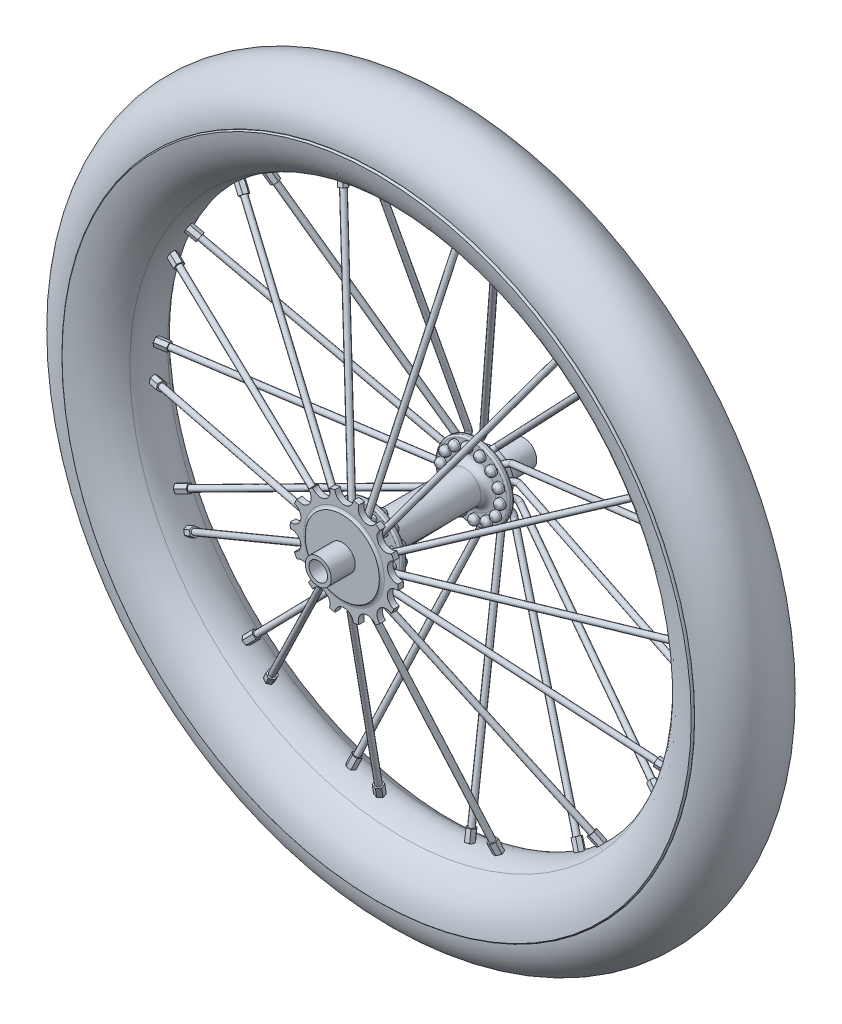
from build123d import *
from build123d.topology import SkipClean

# Parameters (mm, degrees)
BOSS_EXTRUDE1_DEPTH       = 38.5
BOSS_EXTRUDE1_DEPTH_BACK  = 38.5
SKETCH3_R                 = 8.8
SKETCH3_R_2               = 5
SKETCH4_R                 = 4.981501492
BOSS_EXTRUDE2_DEPTH       = 4
SKETCH5_R                 = 11.5
SKETCH5_R_2               = 5
BOSS_EXTRUDE3_DEPTH       = 4
SKETCH6_R                 = 10
SKETCH6_R_2               = 5
BOSS_EXTRUDE4_DEPTH       = 4
FILLET4_R                 = 2
FILLET5_R                 = 2
SKETCH7_W                 = 15
SKETCH7_H                 = 3
FILLET6_R                 = 4
FILLET7_R                 = 1
SKETCH8_R                 = 7
SKETCH8_R_2               = 5
BOSS_EXTRUDE5_DEPTH       = 2
SKETCH9_R                 = 7
SKETCH9_R_2               = 5
BOSS_EXTRUDE8_DEPTH       = 4
SKETCH18_R                = 1.5
BOSS_EXTRUDE14_DEPTH      = 6
BOSS_EXTRUDE15_REACH      = 283.201
SKETCH21_R                = 2.5
FILLET12_R                = 2
CIRPATTERN3_COUNT         = 14
FILLET12_OF_CIRPATTERN3_R = 2
SKETCH22_R                = 1.5
BOSS_EXTRUDE16_REACH      = 282.717
SKETCH23_R                = 2.5
FILLET13_R                = 2
BOSS_EXTRUDE17_DEPTH      = 6
CIRPATTERN9_COUNT         = 14
FILLET13_OF_CIRPATTERN9_R = 2
SKETCH25_R                = 32.935740121
SKETCH25_R_2              = 20
CUT_EXTRUDE1_DEPTH        = 1
FILLET15_R                = 2
BOSS_EXTRUDE18_START      = 13
SKETCH26_R                = 7
SKETCH26_R_2              = 5
BOSS_EXTRUDE18_DEPTH      = 13
SKETCH27_R                = 7
SKETCH27_R_2              = 5
BOSS_EXTRUDE19_DEPTH      = 10.98


with BuildPart() as part:
    # Sketch1 → Revolve2 (revolve)
    with BuildSketch(Plane(origin=(0, 0, 0), x_dir=(0, 0, -1), z_dir=(1, 0, 0))):
        with BuildLine():
            ThreePointArc((-22.5, 170.26), (0, 192.76), (22.5, 170.26))
            ThreePointArc((22.5, 170.26), (23.315391381, 170.379013753), (23.943306285, 169.845393804))
            add(Edge.make_bspline(
                [(23.943306285, 169.845393804), (22.620135463, 160.054080941), (18.884769085, 152.565473915), (10.191867865, 146.984496369)],
                knots=[0, 0, 0, 0, 1, 1, 1, 1], degree=3))
            add(Edge.make_bspline(
                [(-10.191867865, 146.984496369), (-7.742835299, 145.412179439), (0.19376169, 143.732218575), (7.355311919, 145.163383412), (10.191867865, 146.984496369)],
                knots=[0, 0, 0, 0, 0.5, 1, 1, 1, 1], degree=3))
            add(Edge.make_bspline(
                [(-23.943306285, 169.845393804), (-22.620135463, 160.054080941), (-18.884769085, 152.565473915), (-10.191867865, 146.984496369)],
                knots=[0, 0, 0, 0, 1, 1, 1, 1], degree=3))
            ThreePointArc((-23.943306285, 169.845393804), (-23.315391381, 170.379013753), (-22.5, 170.26))
        make_face()
    revolve(axis=Axis((0, 0, 0), (0, 0, 1)))



with BuildPart() as body_2:
    # Sketch3 → Boss-Extrude1 (new, two sides: drawn at the far end of the back side and taken through both)
    with BuildSketch(Plane.XY.offset(-BOSS_EXTRUDE1_DEPTH_BACK)):
        Circle(SKETCH3_R)
        Circle(SKETCH3_R_2, mode=Mode.SUBTRACT)
    extrude(amount=BOSS_EXTRUDE1_DEPTH + BOSS_EXTRUDE1_DEPTH_BACK)

    # Sketch4 → Boss-Extrude2 (add)
    with BuildSketch(Plane.XY.offset(38.5)):
        with BuildLine():
            ThreePointArc((-4.981501492, 28.660299072), (-6.473133969, 28.360652965), (-7.947059966, 27.983429702))
            ThreePointArc((-7.947059966, 27.983429702), (-10.452259275, 21.704340028), (-16.923415485, 23.660644715))
            ThreePointArc((-16.923415485, 23.660644715), (-18.137318336, 22.743477825), (-19.301608733, 21.764098886))
            ThreePointArc((-19.301608733, 21.764098886), (-18.834320413, 15.019869327), (-25.513439489, 13.974709493))
            ThreePointArc((-25.513439489, 13.974709493), (-26.209184367, 12.621677971), (-26.833237172, 11.234121366))
            ThreePointArc((-26.833237172, 11.234121366), (-23.486013404, 5.360529299), (-29.050213901, 1.520911668))
            ThreePointArc((-29.050213901, 1.520911668), (-29.09, 0), (-29.050213901, -1.520911668))
            ThreePointArc((-29.050213901, -1.520911668), (-23.486013404, -5.360529299), (-26.833237172, -11.234121366))
            ThreePointArc((-26.833237172, -11.234121366), (-26.209184367, -12.621677971), (-25.513439489, -13.974709493))
            ThreePointArc((-25.513439489, -13.974709493), (-18.834320413, -15.019869327), (-19.301608733, -21.764098886))
            ThreePointArc((-19.301608733, -21.764098886), (-18.137318336, -22.743477825), (-16.923415485, -23.660644715))
            ThreePointArc((-16.923415485, -23.660644715), (-10.452259275, -21.704340028), (-7.947059966, -27.983429702))
            ThreePointArc((-7.947059966, -27.983429702), (-6.473133969, -28.360652965), (-4.981501492, -28.660299072))
            ThreePointArc((-4.981501492, -28.660299072), (0, -24.09), (4.981501492, -28.660299072))
            ThreePointArc((4.981501492, -28.660299072), (6.473133969, -28.360652965), (7.947059966, -27.983429702))
            ThreePointArc((7.947059966, -27.983429702), (10.452259275, -21.704340028), (16.923415485, -23.660644715))
            ThreePointArc((16.923415485, -23.660644715), (18.137318336, -22.743477825), (19.301608733, -21.764098886))
            ThreePointArc((19.301608733, -21.764098886), (18.834320413, -15.019869327), (25.513439489, -13.974709493))
            ThreePointArc((25.513439489, -13.974709493), (26.209184367, -12.621677971), (26.833237172, -11.234121366))
            ThreePointArc((26.833237172, -11.234121366), (23.486013404, -5.360529299), (29.050213901, -1.520911668))
            ThreePointArc((29.050213901, -1.520911668), (29.09, 0), (29.050213901, 1.520911668))
            ThreePointArc((29.050213901, 1.520911668), (23.486013404, 5.360529299), (26.833237172, 11.234121366))
            ThreePointArc((26.833237172, 11.234121366), (26.209184367, 12.621677971), (25.513439489, 13.974709493))
            ThreePointArc((25.513439489, 13.974709493), (18.834320413, 15.019869327), (19.301608733, 21.764098886))
            ThreePointArc((19.301608733, 21.764098886), (18.137318336, 22.743477825), (16.923415485, 23.660644715))
            ThreePointArc((16.923415485, 23.660644715), (10.452259275, 21.704340028), (7.947059966, 27.983429702))
            ThreePointArc((7.947059966, 27.983429702), (6.473133969, 28.360652965), (4.981501492, 28.660299072))
            ThreePointArc((4.981501492, 28.660299072), (0, 24.09), (-4.981501492, 28.660299072))
        make_face()
        Circle(SKETCH4_R, mode=Mode.SUBTRACT)
    extrude(amount=BOSS_EXTRUDE2_DEPTH)



with BuildPart() as body_3:
    # Sketch5 → Boss-Extrude3 (new body)
    with BuildSketch(Plane(origin=(0, 0, 38.5), x_dir=(-1, 0, 0), z_dir=(0, 0, -1))):
        Circle(SKETCH5_R)
        Circle(SKETCH5_R_2, mode=Mode.SUBTRACT)
    extrude(amount=BOSS_EXTRUDE3_DEPTH)


with BuildPart() as body_4:
    # Sketch6 → Boss-Extrude4 (new body)
    with BuildSketch(Plane(origin=(0, 0, 34.5), x_dir=(-1, 0, 0), z_dir=(0, 0, -1))):
        Circle(SKETCH6_R)
        Circle(SKETCH6_R_2, mode=Mode.SUBTRACT)
    extrude(amount=BOSS_EXTRUDE4_DEPTH)


with BuildPart() as body_5:
    # Mirror2: mirrored copy
    add(body_4.part.mirror(Plane.XY))


with BuildPart() as body_6:
    # Mirror2 2: mirrored copy
    add(body_3.part.mirror(Plane.XY))

    # Fillet5
    fillet5_edges = [body_6.edges().sort_by_distance(p)[0] for p in [
        (11.5, 0, -34.5),
    ]]
    fillet(fillet5_edges, radius=FILLET5_R)


with BuildPart() as body_3_1:
    add(body_3.part)

    # Fillet4
    fillet4_edges = [body_3_1.edges().sort_by_distance(p)[0] for p in [
        (11.5, 0, 34.5),
    ]]
    fillet(fillet4_edges, radius=FILLET4_R)


with BuildPart() as body_2_1:
    add(body_2.part)

    add(body_4.part)  # Revolve3 merges body 4

    add(body_5.part)  # Revolve3 merges body 5
    # Sketch7 → Revolve3 (revolve)
    with BuildSketch(Plane(origin=(0, 0, 0), x_dir=(1, 0, 0), z_dir=(0, 1, 0)), mode=Mode.PRIVATE) as revolve3_sk:
        with Locations((-12.5, 29)):
            Rectangle(SKETCH7_W, SKETCH7_H)
        with Locations((-12.5, -29)):
            Rectangle(SKETCH7_W, SKETCH7_H)
    revolve(revolve3_sk.sketch.rotate(Axis((0, 0, -65.139844077), (0, 0, 1)), 180), axis=Axis((0, 0, -65.139844077), (0, 0, 1)))

    # Fillet6
    fillet6_edges = [body_2_1.edges().sort_by_distance(p)[0] for p in [
        (-8.8, 0, 27.5),
        (-8.8, 0, -27.5),
    ]]
    fillet(fillet6_edges, radius=FILLET6_R)

    # Fillet7
    fillet7_edges = [body_2_1.edges().sort_by_distance(p)[0] for p in [
        (-20, 0, 27.5),
        (-20, 0, 30.5),
        (-20, 0, -27.5),
        (-20, 0, -30.5),
    ]]
    fillet(fillet7_edges, radius=FILLET7_R)

    # Sketch8 → Boss-Extrude5 (add)
    with BuildSketch(Plane.XY.offset(42.5)):
        Circle(SKETCH8_R)
        with Locations(Location((0, 0, 0), (0, 0, 180))):
            Circle(SKETCH8_R_2, mode=Mode.SUBTRACT)
    extrude(amount=BOSS_EXTRUDE5_DEPTH)


    with SkipClean():  # the faces are left unmerged after this step: merging them gives an invalid solid
        add(body_6.part)  # Boss-Extrude8 merges body 6
        # Sketch9 → Boss-Extrude8 (add)
        with BuildSketch(Plane(origin=(0, 0, -38.5), x_dir=(-1, 0, 0), z_dir=(0, 0, -1))):
            with Locations(Location((0, 0, 0), (0, 0, 180))):
                Circle(SKETCH9_R)
            Circle(SKETCH9_R_2, mode=Mode.SUBTRACT)
        extrude(amount=BOSS_EXTRUDE8_DEPTH)


with BuildPart() as part_1:
    add(part.part)

    add(body_2_1.part)  # Sweep3 merges body 2
    # Sweep3: sweep along a curve in space
    with BuildLine() as sweep3_path:
        Line((-19.163004198, 3.603154675, -34.508286843), (-126.966537307, 69.032036164, -1.285413134))
        ThreePointArc((-15.945035065, 1.650082127, -31.607274386), (-16.944140106, 2.256466014, -33.983494651), (-19.163004198, 3.603154675, -34.508286843))
        Line((-15.945035065, 1.650082127, -27.5), (-15.945035065, 1.650082127, -31.607274386))
        Line((-15.945035065, 1.650082127, -27.5), (-15.945035065, 1.650082127, -24.5))
    # Sketch18 → Sweep3 (sweep)
    with BuildSketch(Plane(origin=(-126.966537307, 69.032036164, -1.285413134), x_dir=(0.21778703603627805, -0.1321808456530245, 0.9670041525127926), z_dir=(-0.826662203438829, 0.5017236613741118, 0.25476061120788623))):
        Circle(SKETCH18_R)
    sweep3 = sweep(path=sweep3_path.line)

    # Sketch20 → Boss-Extrude14 (add)
    with BuildSketch(Plane(origin=(-126.966537307, 69.032036164, -1.285413134), x_dir=(0.21778703603627805, -0.1321808456530245, 0.9670041525127926), z_dir=(-0.826662203438829, 0.5017236613741118, 0.25476061120788623))):
        Polygon((-2.229914802, -0.775034798), (-0.443757577, -2.318680265), (1.786157225, -1.543645468), (2.229914802, 0.775034798), (0.443757577, 2.318680265), (-1.786157225, 1.543645468), align=None)
    boss_extrude14 = extrude(amount=-BOSS_EXTRUDE14_DEPTH)

    # Sketch21 → Boss-Extrude15 (add, up to next)
    with BuildSketch(Plane.XY.offset(-24.5), mode=Mode.PRIVATE) as boss_extrude15_sk1:
        with Locations((-15.945035065, 1.650082127)):
            Circle(SKETCH21_R)
    boss_extrude15_tool1 = extrude(boss_extrude15_sk1.sketch, amount=-BOSS_EXTRUDE15_REACH, mode=Mode.PRIVATE) - part_1.part
    boss_extrude15 = boss_extrude15_tool1.solids().sort_by_distance((-15.945035, 1.650082, -24.5))[0]
    add(boss_extrude15)

    # Fillet12
    fillet12_edges = [part_1.edges().sort_by_distance(p)[0] for p in [
        (-18.445035065, 1.650082127, -24.5),
    ]]
    fillet(fillet12_edges, radius=FILLET12_R)

    # CirPattern3: Sweep3, Boss-Extrude14, Boss-Extrude15 ×14 about axis
    cirpattern3_axis = Axis((0, 0, 0), (0, 0, 1))
    add([sweep3.rotate(cirpattern3_axis, i * 360 / CIRPATTERN3_COUNT) for i in range(1, CIRPATTERN3_COUNT)])
    add([boss_extrude14.rotate(cirpattern3_axis, i * 360 / CIRPATTERN3_COUNT) for i in range(1, CIRPATTERN3_COUNT)])
    add([boss_extrude15.rotate(cirpattern3_axis, i * 360 / CIRPATTERN3_COUNT) for i in range(1, CIRPATTERN3_COUNT)])

    # Fillet12 of CirPattern3
    fillet12_of_cirpattern3_edges = [part_1.edges().sort_by_distance(p)[0] for p in [
        (-17.334346164, -6.516328156, -24.5),
        (-12.790377413, -13.39209973, -24.5),
        (-5.713117553, -17.61540171, -24.5),
        (2.495695306, -18.349757342, -24.5),
        (10.210205102, -15.449718487, -24.5),
        (15.902458557, -9.489673408, -24.5),
        (18.445035065, -1.650082127, -24.5),
        (17.334346164, 6.516328156, -24.5),
        (12.790377413, 13.39209973, -24.5),
        (5.713117553, 17.61540171, -24.5),
        (-2.495695306, 18.349757342, -24.5),
        (-10.210205102, 15.449718487, -24.5),
        (-15.902458557, 9.489673408, -24.5),
    ]]
    fillet(fillet12_of_cirpattern3_edges, radius=FILLET12_OF_CIRPATTERN3_R)

    # Sweep4: sweep along a curve in space
    with BuildLine() as sweep4_path:
        Line((11.039953281, -16.260556463, 34.455429514), (97.885428149, -106.309582887, 0.029362449))
        ThreePointArc((8.404850651, -13.528250298, 31.562946489), (9.225199463, -14.378860096, 33.949142253), (11.039953281, -16.260556463, 34.455429514))
        Line((8.404850651, -13.528250298, 27.5), (8.404850651, -13.528250298, 31.562946489))
        Line((8.404850651, -13.528250298, 27.5), (8.404850651, -13.528250298, 24.5))
    # Sketch22 → Sweep4 (sweep)
    with BuildSketch(Plane(origin=(97.885428149, -106.309582887, 0.029362449), x_dir=(-0.7429847823239595, -0.6251789439531353, -0.23900816151893442), z_dir=(0.669308309551748, -0.6939977211662425, -0.26531782786131025))):
        Circle(SKETCH22_R)
    sweep4 = sweep(path=sweep4_path.line)

    # Sketch23 → Boss-Extrude16 (add, up to next)
    with BuildSketch(Plane(origin=(0, 0, 24.5), x_dir=(-1, 0, 0), z_dir=(0, 0, -1)), mode=Mode.PRIVATE) as boss_extrude16_sk1:
        with Locations((-8.404850651, -13.528250298)):
            Circle(SKETCH23_R)
    boss_extrude16_tool1 = extrude(boss_extrude16_sk1.sketch, amount=-BOSS_EXTRUDE16_REACH, mode=Mode.PRIVATE) - part_1.part
    boss_extrude16 = boss_extrude16_tool1.solids().sort_by_distance((8.404851, -13.52825, 24.5))[0]
    add(boss_extrude16)

    # Fillet13
    fillet13_edges = [part_1.edges().sort_by_distance(p)[0] for p in [
        (10.904850651, -13.528250298, 24.5),
    ]]
    fillet(fillet13_edges, radius=FILLET13_R)

    # Sketch24 → Boss-Extrude17 (add)
    with BuildSketch(Plane(origin=(97.885428149, -106.309582887, 0.029362449), x_dir=(-0.7429847823239595, -0.6251789439531353, -0.23900816151893442), z_dir=(0.669308309551748, -0.6939977211662425, -0.26531782786131025))):
        Polygon((1.205263591, 2.102784215), (-1.218432753, 2.095180996), (-2.423696344, -0.007603219), (-1.205263591, -2.102784215), (1.218432753, -2.095180996), (2.423696344, 0.007603219), align=None)
    boss_extrude17 = extrude(amount=-BOSS_EXTRUDE17_DEPTH)

    # CirPattern9: Sweep4, Boss-Extrude16, Boss-Extrude17 ×14 about axis
    cirpattern9_axis = Axis((0, 0, 0), (0, 0, 1))
    add([sweep4.rotate(cirpattern9_axis, i * 360 / CIRPATTERN9_COUNT) for i in range(1, CIRPATTERN9_COUNT)])
    add([boss_extrude16.rotate(cirpattern9_axis, i * 360 / CIRPATTERN9_COUNT) for i in range(1, CIRPATTERN9_COUNT)])
    add([boss_extrude17.rotate(cirpattern9_axis, i * 360 / CIRPATTERN9_COUNT) for i in range(1, CIRPATTERN9_COUNT)])

    # Fillet13 of CirPattern9
    fillet13_of_cirpattern9_edges = [part_1.edges().sort_by_distance(p)[0] for p in [
        (15.694618769, -7.457094981, 24.5),
        (17.375875158, 0.091029453, 24.5),
        (15.61562637, 7.621124387, 24.5),
        (10.762511267, 13.641762169, 24.5),
        (3.777748814, 16.960481649, 24.5),
        (-3.955243122, 16.919969731, 24.5),
        (-10.904850651, 13.528250298, 24.5),
        (-15.694618769, 7.457094981, 24.5),
        (-17.375875158, -0.091029453, 24.5),
        (-15.61562637, -7.621124387, 24.5),
        (-10.762511267, -13.641762169, 24.5),
        (-3.777748814, -16.960481649, 24.5),
        (3.955243122, -16.919969731, 24.5),
    ]]
    fillet(fillet13_of_cirpattern9_edges, radius=FILLET13_OF_CIRPATTERN9_R)

    # Sketch25 → Cut-Extrude1 (cut)
    with BuildSketch(Plane.XY.offset(42.5)):
        Circle(SKETCH25_R)
        with Locations(Location((0, 0, 0), (0, 0, 180))):
            Circle(SKETCH25_R_2, mode=Mode.SUBTRACT)
    extrude(amount=-CUT_EXTRUDE1_DEPTH, mode=Mode.SUBTRACT)

    # Fillet15
    # the kernel refuses this fillet: 2 mm, written as the material it adds along each edge
    with BuildSketch(Plane(origin=(0, 0, 41.5), x_dir=(-1, 0, 0), z_dir=(0, 1, 0))) as fillet15_piece_1:
        with BuildLine():
            CenterArc((21.732050808, 2), FILLET15_R, 210, 60)
            Line((20, 1), (19.965358984, 0.98))
            ThreePointArc((19.965358984, 0.98), (19.96, 0.5), (19.96, 0))
            Line((19.96, 0), (20, -0.04))
            Line((20, -0.04), (21.732050808, -0.04))
            Line((21.732050808, -0.04), (21.732050808, 0))
        make_face()
    revolve(axis=Axis((0, 0, 41.5), (0, 0, 1)))

    # Sketch26 → Boss-Extrude18 (add)
    with BuildSketch(Plane(origin=(0, 0, -42.5), x_dir=(-1, 0, 0), z_dir=(0, 0, -1)).offset(BOSS_EXTRUDE18_START)):
        with Locations(Location((0, 0, 0), (0, 0, 180))):
            Circle(SKETCH26_R)
        Circle(SKETCH26_R_2, mode=Mode.SUBTRACT)
    extrude(amount=-BOSS_EXTRUDE18_DEPTH)

    # Sketch27 → Boss-Extrude19 (add)
    with BuildSketch(Plane.XY.offset(44.5)):
        Circle(SKETCH27_R)
        with Locations(Location((0, 0, 0), (0, 0, 180))):
            Circle(SKETCH27_R_2, mode=Mode.SUBTRACT)
    extrude(amount=BOSS_EXTRUDE19_DEPTH)


solid = Compound([body_3_1.part, part_1.part])
